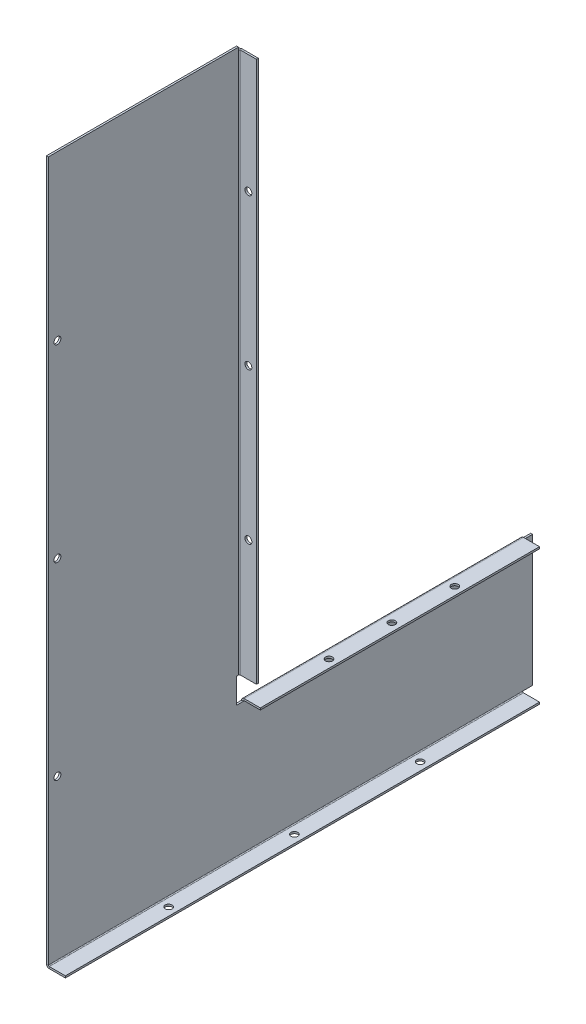
from build123d import *

# Parameters (mm, degrees)
SKETCH_2_W                       = 1.5
SKETCH_2_H                       = 108.5
SM_BASE_FLANGE_1_DEPTH           = 385
SM_EDGE_FLANGE_2_STRIP_W         = 7.4732
SM_EDGE_FLANGE_2_STRIP_H         = 1.5
SM_EDGE_FLANGE_2_STRIP_CUT_DEPTH = 385
SM_EDGE_FLANGE_2_DEPTH           = 385
SKETCH_13_W                      = 19.831026495
SKETCH_13_H                      = 4.393295337
CUT_EXTRUDE_1_DEPTH              = 8
SM_EDGE_FLANGE_3_STRIP_W         = 7.4732
SM_EDGE_FLANGE_3_STRIP_H         = 1.5
SM_EDGE_FLANGE_3_STRIP_CUT_DEPTH = 385
SM_EDGE_FLANGE_3_DEPTH           = 385
SKETCH_18_W                      = 20.05650784
SKETCH_18_H                      = 5.183741357
CUT_EXTRUDE_2_DEPTH              = 8
SKETCH_19_W                      = 25.725423763
SKETCH_19_H                      = 11.342633063
CUT_EXTRUDE_3_DEPTH              = 140
SKETCH_20_W                      = 20.859346665
SKETCH_20_H                      = 6.188811882
CUT_EXTRUDE_4_DEPTH              = 15
SKETCH_21_W                      = 1.5
SKETCH_21_H                      = 153.4
EXTRUDE_1_DEPTH                  = 452.41
SKETCH_22_R                      = 2.75
CUT_EXTRUDE_5_DEPTH              = 20
SKETCH_23_R                      = 2.75
CUT_EXTRUDE_6_DEPTH              = 20
SKETCH_24_R                      = 2.75
CUT_EXTRUDE_7_DEPTH              = 20
SKETCH_28_W                      = 3.977690792
SKETCH_28_H                      = 20
CUT_EXTRUDE_8_DEPTH              = 10
SM_EDGE_FLANGE_5_STRIP_W         = 7.4732
SM_EDGE_FLANGE_5_STRIP_H         = 1.5
SM_EDGE_FLANGE_5_STRIP_CUT_DEPTH = 432.41
SM_EDGE_FLANGE_5_DEPTH           = 432.41
SKETCH_32_R                      = 2.75
CUT_EXTRUDE_9_DEPTH              = 10
CUT_EXTRUDE_START                = -2
CUT_EXTRUDE_10_DEPTH             = 2


# Read off the part's stored shape, not the designer's step: 切除-拉伸10
# Sheet-metal steps are written as plain solids
with BuildPart() as part:
    # Sketch 2 → 基体-法兰1 (new body)
    with BuildSketch(Plane.XY):
        with Locations((0.75, 54.25)):
            Rectangle(SKETCH_2_W, SKETCH_2_H)
    extrude(amount=SM_BASE_FLANGE_1_DEPTH)

    # 边线-法兰2 strip (across the edge) → 边线-法兰2 strip cut (cut)
    with BuildSketch(Plane(origin=(1.5, 0, 385), x_dir=(0, 1, 0), z_dir=(0, 0, -1))):
        with Locations((-1.5, -0.75)):
            Rectangle(SM_EDGE_FLANGE_2_STRIP_W, SM_EDGE_FLANGE_2_STRIP_H)
    extrude(amount=SM_EDGE_FLANGE_2_STRIP_CUT_DEPTH, mode=Mode.SUBTRACT)

    # 边线-法兰2 section (across the edge) → 边线-法兰2 (add)
    with BuildSketch(Plane(origin=(1.5, 0, 385), x_dir=(0, 1, 0), z_dir=(0, 0, -1))):
        with BuildLine():
            Line((0, 0.7366), (0, 13.5))
            Line((0, 13.5), (1.5, 13.5))
            Line((1.5, 13.5), (1.5, 0.7366))
            ThreePointArc((1.5, 0.7366), (1.715745145, 0.215745145), (2.2366, 0))
            Line((2.2366, 0), (2.2366, -1.5))
            ThreePointArc((2.2366, -1.5), (0.655084973, -0.844915027), (0, 0.7366))
        make_face()
    extrude(amount=SM_EDGE_FLANGE_2_DEPTH)

    # 草图13 → 切除-拉伸1 (cut)
    with BuildSketch(Plane(origin=(0, 0, 0), x_dir=(-1, 0, 0), z_dir=(0, 0, -1))):
        with Locations((-9.915513247, 0.039952332)):
            Rectangle(SKETCH_13_W, SKETCH_13_H)
    extrude(amount=-CUT_EXTRUDE_1_DEPTH, mode=Mode.SUBTRACT)

    # 边线-法兰3 strip (across the edge) → 边线-法兰3 strip cut (cut)
    with BuildSketch(Plane(origin=(1.5, 108.5, 0), x_dir=(0, -1, 0), z_dir=(0, 0, 1))):
        with Locations((-1.5, -0.75)):
            Rectangle(SM_EDGE_FLANGE_3_STRIP_W, SM_EDGE_FLANGE_3_STRIP_H)
    extrude(amount=SM_EDGE_FLANGE_3_STRIP_CUT_DEPTH, mode=Mode.SUBTRACT)

    # 边线-法兰3 section (across the edge) → 边线-法兰3 (add)
    with BuildSketch(Plane(origin=(1.5, 108.5, 0), x_dir=(0, -1, 0), z_dir=(0, 0, 1))):
        with BuildLine():
            Line((0, 0.7366), (0, 13.5))
            Line((0, 13.5), (1.5, 13.5))
            Line((1.5, 13.5), (1.5, 0.7366))
            ThreePointArc((1.5, 0.7366), (1.715745145, 0.215745145), (2.2366, 0))
            Line((2.2366, 0), (2.2366, -1.5))
            ThreePointArc((2.2366, -1.5), (0.655084973, -0.844915027), (0, 0.7366))
        make_face()
    extrude(amount=SM_EDGE_FLANGE_3_DEPTH)

    # 草图18 → 切除-拉伸2 (cut)
    with BuildSketch(Plane(origin=(0, 0, 0), x_dir=(-1, 0, 0), z_dir=(0, 0, -1))):
        with Locations((-10.02825392, 108.855270679)):
            Rectangle(SKETCH_18_W, SKETCH_18_H)
    extrude(amount=-CUT_EXTRUDE_2_DEPTH, mode=Mode.SUBTRACT)

    # 草图19 → 切除-拉伸3 (cut)
    with BuildSketch(Plane.XY.offset(385)):
        with Locations((12.862711882, 111.934716532)):
            Rectangle(SKETCH_19_W, SKETCH_19_H)
    extrude(amount=-CUT_EXTRUDE_3_DEPTH, mode=Mode.SUBTRACT)

    # 草图20 → 切除-拉伸4 (cut)
    with BuildSketch(Plane.XY.offset(245)):
        with Locations((10.429673333, 109.357805941)):
            Rectangle(SKETCH_20_W, SKETCH_20_H)
    extrude(amount=-CUT_EXTRUDE_4_DEPTH, mode=Mode.SUBTRACT)

    # 草图21 → 凸台-拉伸1 (add)
    with BuildSketch(Plane(origin=(0, 106.2634, 0), x_dir=(1, 0, 0), z_dir=(0, 1, 0))):
        with Locations((0.75, -308.3)):
            Rectangle(SKETCH_21_W, SKETCH_21_H)
    extrude(amount=EXTRUDE_1_DEPTH)

    # 草图22 → 切除-拉伸5 (cut)
    with BuildSketch(Plane.XZ.offset(-107)):
        with Locations((8.6183, 69)):
            Circle(SKETCH_22_R)
        with Locations((8.6183, 169)):
            Circle(SKETCH_22_R)
        with Locations((8.6183, 119)):
            Circle(SKETCH_22_R)
    extrude(amount=-CUT_EXTRUDE_5_DEPTH, mode=Mode.SUBTRACT)

    # 草图23 → 切除-拉伸6 (cut)
    with BuildSketch(Plane(origin=(0, 1.5, 0), x_dir=(1, 0, 0), z_dir=(0, 1, 0))):
        with Locations(Location((8.6183, -96.5, 0), (0, 0, 180))):
            Circle(SKETCH_23_R)
        with Locations(Location((8.6183, -196.5, 0), (0, 0, 180))):
            Circle(SKETCH_23_R)
        with Locations((8.6183, -296.5)):
            Circle(SKETCH_23_R)
    extrude(amount=-CUT_EXTRUDE_6_DEPTH, mode=Mode.SUBTRACT)

    # 草图24 → 切除-拉伸7 (cut)
    with BuildSketch(Plane(origin=(1.5, 0, 0), x_dir=(0, 0, -1), z_dir=(1, 0, 0))):
        with Locations((-377.815462169, 128.5882)):
            Circle(SKETCH_24_R)
        with Locations((-377.815462169, 278.5882)):
            Circle(SKETCH_24_R)
        with Locations((-377.815462169, 428.5882)):
            Circle(SKETCH_24_R)
    extrude(amount=-CUT_EXTRUDE_7_DEPTH, mode=Mode.SUBTRACT)

    # 草图28 → 切除-拉伸8 (cut)
    with BuildSketch(Plane(origin=(1.5, 0, 0), x_dir=(0, 0, -1), z_dir=(1, 0, 0))):
        with Locations((-233.588845396, 116.2634)):
            Rectangle(SKETCH_28_W, SKETCH_28_H)
    extrude(amount=-CUT_EXTRUDE_8_DEPTH, mode=Mode.SUBTRACT)

    # 边线-法兰5 strip (across the edge) → 边线-法兰5 strip cut (cut)
    with BuildSketch(Plane(origin=(1.5, 126.2634, 231.6), x_dir=(0, 0, 1), z_dir=(0, 1, 0))):
        with Locations((-1.5, -0.75)):
            Rectangle(SM_EDGE_FLANGE_5_STRIP_W, SM_EDGE_FLANGE_5_STRIP_H)
    extrude(amount=SM_EDGE_FLANGE_5_STRIP_CUT_DEPTH, mode=Mode.SUBTRACT)

    # 边线-法兰5 section (across the edge) → 边线-法兰5 (add)
    with BuildSketch(Plane(origin=(1.5, 126.2634, 231.6), x_dir=(0, 0, 1), z_dir=(0, 1, 0))):
        with BuildLine():
            Line((0, 0.7366), (0, 13.5))
            Line((0, 13.5), (1.5, 13.5))
            Line((1.5, 13.5), (1.5, 0.7366))
            ThreePointArc((1.5, 0.7366), (1.715745145, 0.215745145), (2.2366, 0))
            Line((2.2366, 0), (2.2366, -1.5))
            ThreePointArc((2.2366, -1.5), (0.655084973, -0.844915027), (0, 0.7366))
        make_face()
    extrude(amount=SM_EDGE_FLANGE_5_DEPTH)

    # 草图32 → 切除-拉伸9 (cut)
    with BuildSketch(Plane.XY.offset(233.1)):
        with Locations((8.6183, 462.4684)):
            Circle(SKETCH_32_R)
        with Locations((8.6183, 342.4684)):
            Circle(SKETCH_32_R)
        with Locations(Location((8.6183, 222.4684, 0), (0, 0, 180))):
            Circle(SKETCH_32_R)
    extrude(amount=-CUT_EXTRUDE_9_DEPTH, mode=Mode.SUBTRACT)

    # 切除-拉伸10 outline → 切除-拉伸10 (cut)
    with BuildSketch(Plane(origin=(0, 558.6734, 0), x_dir=(1, 0, 0), z_dir=(0, 1, 0)).offset(CUT_EXTRUDE_START)):
        with BuildLine():
            ThreePointArc((2.2366, -231.6), (0.655084973, -232.255084973), (0, -233.8366))
            Line((0, -233.8366), (1.5, -233.8366))
            ThreePointArc((1.5, -233.8366), (1.715745145, -233.315745145), (2.2366, -233.1))
            Line((2.2366, -233.1), (15, -233.1))
            Line((15, -233.1), (15, -231.6))
            Line((15, -231.6), (2.2366, -231.6))
        make_face()
    extrude(amount=CUT_EXTRUDE_10_DEPTH, mode=Mode.SUBTRACT)


solid = part.part
